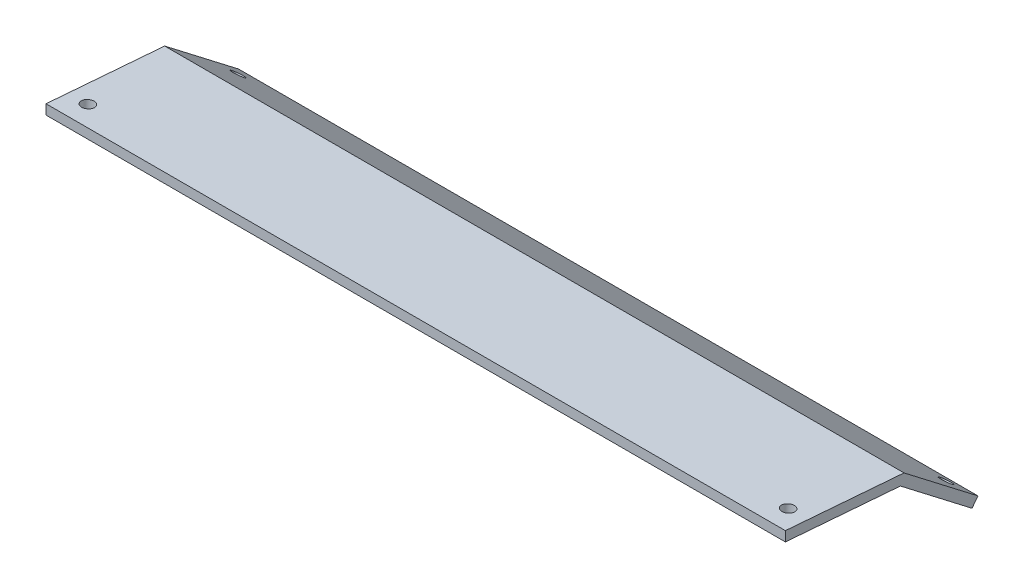
from build123d import *

# Parameters (mm, degrees)
BOSS_EXTRUDE1_DEPTH = 119.85625
SKETCH2_R           = 2.032
CUT_EXTRUDE1_DEPTH  = 138.14106245
SKETCH3_R           = 2.032
CUT_EXTRUDE2_DEPTH  = 12.7


with BuildPart() as part:
    # Sketch1 → Boss-Extrude1 (new, symmetric)
    with BuildSketch(Plane(origin=(0, 0, 0), x_dir=(0, 0, -1), z_dir=(1, 0, 0))):
        Polygon((0, 0), (0, 3.184811635), (38.465548487, 0.158448697), (62.440724647, -18.283648309), (60.504915811, -20.800247036), (37.276849883, -2.93283942), align=None)
    extrude(amount=BOSS_EXTRUDE1_DEPTH, both=True)

    # Sketch2 → Cut-Extrude1 (cut, through all)
    with BuildSketch(Plane(origin=(0, 3.165218593, -0.249030642), x_dir=(1, 0, 0), z_dir=(0, 0.9969192417821154, -0.0784348478966589))):
        with Locations((113.50625, 7.004911129)):
            Circle(SKETCH2_R)
        with Locations((-113.50625, 7.004911129)):
            Circle(SKETCH2_R)
    extrude(amount=-CUT_EXTRUDE1_DEPTH, mode=Mode.SUBTRACT)

    # Sketch3 → Cut-Extrude2 (cut)
    with BuildSketch(Plane(origin=(0, 18.688756239, -14.375696478), x_dir=(1, 0, 0), z_dir=(0, 0.792629520261329, -0.6097035702784556))):
        with Locations((-113.50625, 52.384967273)):
            Circle(SKETCH3_R)
        with Locations((113.50625, 55.559967273)):
            Circle(SKETCH3_R)
    extrude(amount=-CUT_EXTRUDE2_DEPTH, mode=Mode.SUBTRACT)


solid = part.part
